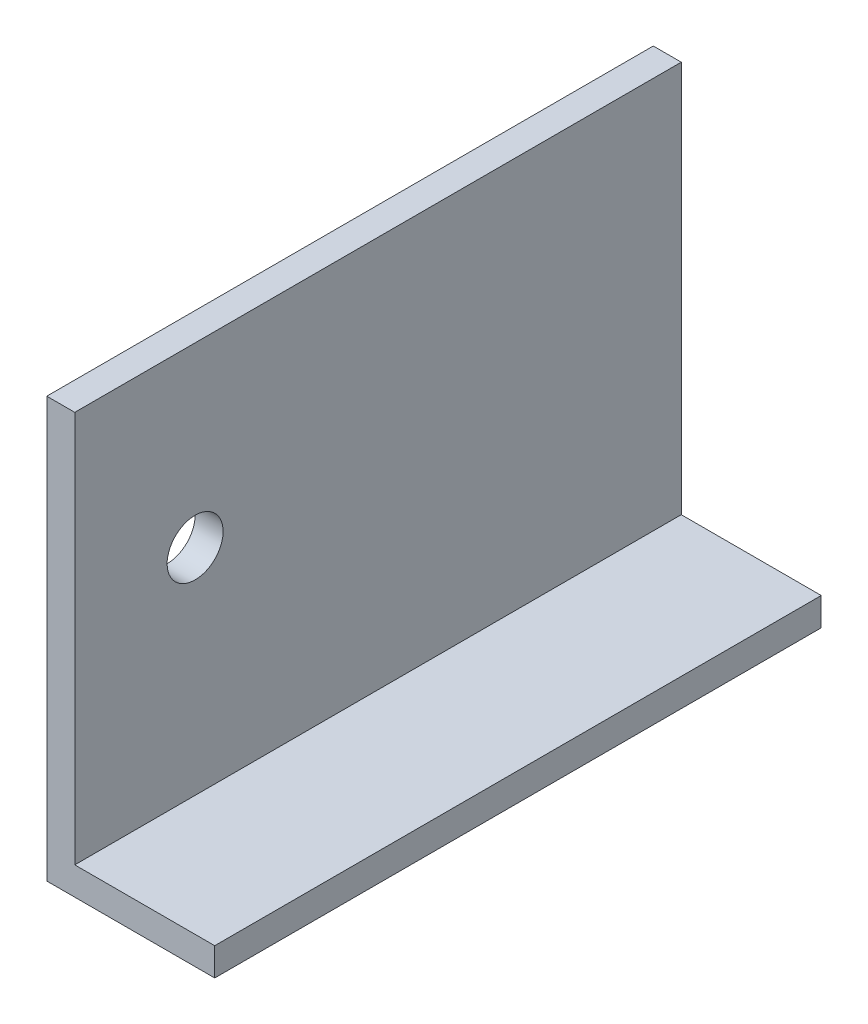
from build123d import *

# Parameters (mm, degrees)
SKETCH_1_W          = 15
SKETCH_1_H          = 3
EXTRUDE_1_DEPTH     = 65
SKETCH_2_R          = 3
CUT_EXTRUDE_1_DEPTH = 64.5


with BuildPart() as part:
    # 草图1 → 凸台-拉伸1 (new body)
    with BuildSketch(Plane.XY):
        Polygon((3, 45), (0, 45), (0, 0), (3, 0), (3, 3), align=None)
        with Locations((10.5, 1.5)):
            Rectangle(SKETCH_1_W, SKETCH_1_H)
    extrude(amount=EXTRUDE_1_DEPTH)

    # 草图2 → 切除-拉伸1 (cut)
    with BuildSketch(Plane(origin=(3, 0, 0), x_dir=(0, 0, -1), z_dir=(1, 0, 0))):
        with Locations((-52.1, 26)):
            Circle(SKETCH_2_R)
    extrude(amount=-CUT_EXTRUDE_1_DEPTH, mode=Mode.SUBTRACT)


solid = part.part
